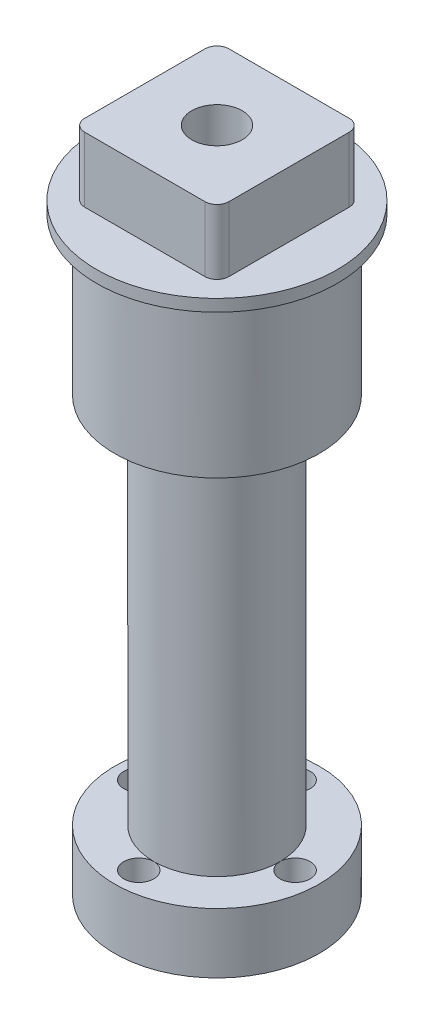
from build123d import *

# Parameters (mm, degrees)
CUT_EXTRUDE_START       = -50
CUT_EXTRUDE_2_OUTLINE_R = 1.25
CUT_EXTRUDE_2_DEPTH     = 5
SKETCH_4_W              = 12
SKETCH_4_H              = 12
EXTRUDE_1_DEPTH         = 5.4
FILLET_1_R              = 1
SKETCH_5_W              = 1.5
SKETCH_5_H              = 1
SKETCH_6_R              = 4.25
EXTRUDE_2_DEPTH         = 6
HOLE_WIZARD_M5_2_D      = 4.2


# Read off the part's stored shape, not the designer's step: 凸台-拉伸1
with BuildPart() as part:
    # 草图1 → 旋转1 (revolve)
    with BuildSketch(Plane.XY, mode=Mode.PRIVATE) as revolve_1_sk:
        Polygon((-8.5, 36), (-5.25, 36), (-5.25, 5), (-8.5, 5), (-8.5, 0), (-4.25, 0), (-4.25, 50), (-8.5, 50), align=None)
    revolve(revolve_1_sk.sketch.rotate(Axis((0, 0, 0), (0, 1, 0)), 270), axis=Axis((0, 0, 0), (0, 1, 0)))

    # 切除-拉伸2 outline → 切除-拉伸2 (cut)
    with BuildSketch(Plane(origin=(0, 50, 0), x_dir=(1, 0, 0), z_dir=(0, 1, 0)).offset(CUT_EXTRUDE_START)):
        with Locations((6.5, 0)):
            Circle(CUT_EXTRUDE_2_OUTLINE_R)
        with Locations((-6.5, 0)):
            Circle(CUT_EXTRUDE_2_OUTLINE_R)
        with Locations((0, -6.5)):
            Circle(CUT_EXTRUDE_2_OUTLINE_R)
        with Locations((0, 6.5)):
            Circle(CUT_EXTRUDE_2_OUTLINE_R)
    extrude(amount=CUT_EXTRUDE_2_DEPTH, mode=Mode.SUBTRACT)

    # 草图4 → 凸台-拉伸1 (add)
    with BuildSketch(Plane(origin=(0, 50, 0), x_dir=(1, 0, 0), z_dir=(0, 1, 0))):
        Rectangle(SKETCH_4_W, SKETCH_4_H)
    extrude(amount=EXTRUDE_1_DEPTH)

    # 圆角1
    fillet_1_edges = [part.edges().sort_by_distance(p)[0] for p in [
        (6, 52.7, 6),
        (6, 52.7, -6),
        (-6, 52.7, -6),
        (-6, 52.7, 6),
    ]]
    fillet(fillet_1_edges, radius=FILLET_1_R)

    # 草图5 → 旋转2 (revolve)
    with BuildSketch(Plane.XY, mode=Mode.PRIVATE) as revolve_2_sk:
        with Locations((-9.25, 49.5)):
            Rectangle(SKETCH_5_W, SKETCH_5_H)
    revolve(revolve_2_sk.sketch.rotate(Axis((0, 0, 0), (0, 1, 0)), 270), axis=Axis((0, 0, 0), (0, 1, 0)))

    # 草图6 → 凸台-拉伸2 (add)
    with BuildSketch(Plane.XZ.offset(-50)):
        with Locations(Location((0, 0, 0), (0, 0, 270))):
            Circle(SKETCH_6_R)
    extrude(amount=EXTRUDE_2_DEPTH)

    # M5 螺纹孔2 (through all)
    with Locations(Plane(origin=(0, 55.4, 0), x_dir=(1, 0, 0), z_dir=(0, 1, 0))):
        with Locations((0, 0)):
            Hole(HOLE_WIZARD_M5_2_D / 2)


solid = part.part
